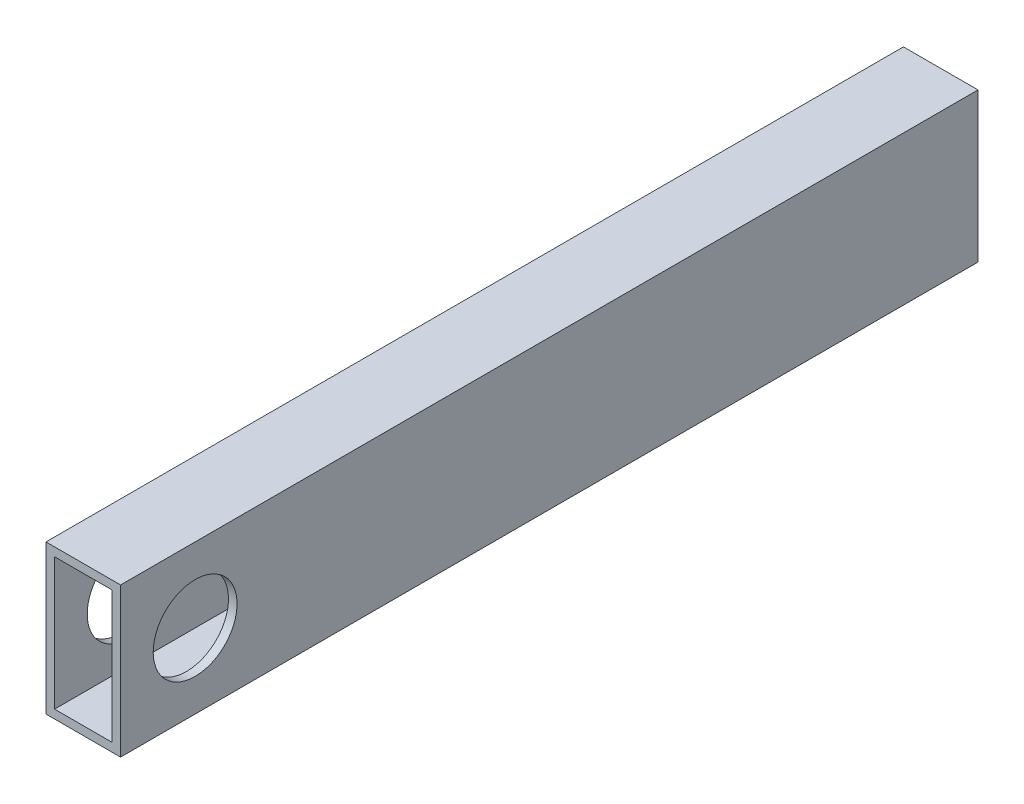
from build123d import *

# Parameters (mm, degrees)
F_2X1_BLANK_EXTRUSION_OUTLINE_W   = 25.4
F_2X1_BLANK_EXTRUSION_OUTLINE_H   = 50.8
F_2X1_BLANK_EXTRUSION_OUTLINE_W_2 = 19.558
F_2X1_BLANK_EXTRUSION_OUTLINE_H_2 = 44.958
F_2X1_BLANK_EXTRUSION_DEPTH       = 292.1
CUT_EXTRUDE1_DEPTH                = 295.300407747
CUT_EXTRUDE1_DEPTH_BACK           = 295.300407747
SKETCH1_R                         = 14.2875


# Read off the part's stored shape, not the designer's step: 2x1 blank extrusion
with BuildPart() as part:
    # 2x1 blank extrusion outline → 2x1 blank extrusion (new body)
    with BuildSketch(Plane.XY):
        Rectangle(F_2X1_BLANK_EXTRUSION_OUTLINE_W, F_2X1_BLANK_EXTRUSION_OUTLINE_H)
        Rectangle(F_2X1_BLANK_EXTRUSION_OUTLINE_W_2, F_2X1_BLANK_EXTRUSION_OUTLINE_H_2, mode=Mode.SUBTRACT)
    extrude(amount=F_2X1_BLANK_EXTRUSION_DEPTH)

    # Sketch1 → Cut-Extrude1 (cut, two sides: drawn at the far end of the back side and taken through both)
    with BuildSketch(Plane(origin=(12.7, 0, 0), x_dir=(0, 0, -1), z_dir=(1, 0, 0)).offset(-CUT_EXTRUDE1_DEPTH_BACK)):
        with Locations(Location((-266.7, 0, 0), (0, 0, 180))):
            Circle(SKETCH1_R)
    extrude(amount=CUT_EXTRUDE1_DEPTH + CUT_EXTRUDE1_DEPTH_BACK, mode=Mode.SUBTRACT)


solid = part.part
